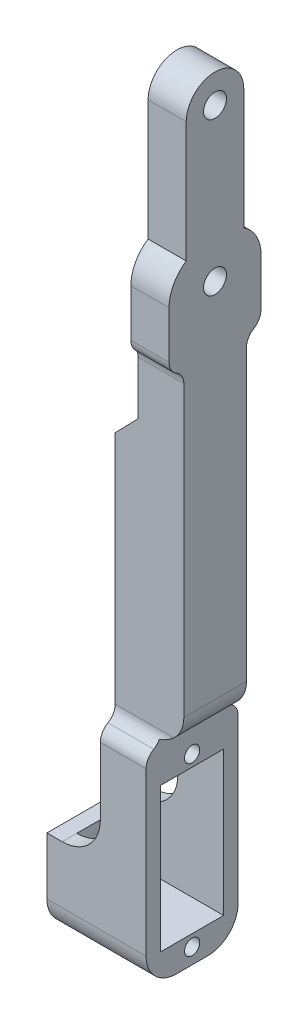
from build123d import *

# Parameters (mm, degrees)
SKETCH1_R               = 10
SKETCH1_R_2             = 0.8
SKETCH1_R_3             = 3.301767793
BOSS_EXTRUDE1_DEPTH     = 1.5
SKETCH2_R               = 10
BOSS_EXTRUDE2_DEPTH     = 9
CUT_EXTRUDE1_DEPTH      = 93.583714931
CUT_EXTRUDE1_DEPTH_BACK = 93.583714931
SKETCH3_R               = 1.5
FILLET1_R               = 5
SKETCH4_R               = 1.5
BOSS_EXTRUDE3_DEPTH     = 5
CUT_EXTRUDE2_DEPTH      = 4
FILLET3_R               = 2
SKETCH6_W               = 12.069016708
SKETCH6_H               = 36.150412664
BOSS_EXTRUDE4_DEPTH     = 9
CUT_EXTRUDE3_DEPTH      = 112.059195252
CUT_EXTRUDE3_DEPTH_BACK = 112.059195252
CUT_EXTRUDE4_DEPTH      = 111.336877259
CUT_EXTRUDE4_DEPTH_BACK = 111.336877259
SKETCH8_R               = 1
SKETCH8_W               = 8.25
SKETCH8_H               = 18.9
FILLET4_R               = 4
SKETCH9_W               = 24.382356312
SKETCH9_H               = 35.371587325
CUT_EXTRUDE5_DEPTH      = 3
FILLET5_R               = 4
SKETCH10_R              = 20.065343601
CUT_EXTRUDE6_DEPTH      = 3
CUT_EXTRUDE7_DEPTH      = 111.33687725
CUT_EXTRUDE7_DEPTH_BACK = 111.33687725
FILLET6_R               = 2
CHAMFER1_SIZE           = 3
BOSS_EXTRUDE5_START     = 7
SKETCH12_R              = 1
BOSS_EXTRUDE5_DEPTH     = 7
SKETCH13_W              = 8.25
SKETCH13_H              = 7.955873605
CUT_EXTRUDE8_DEPTH      = 5
FILLET7_R               = 5
SKETCH14_W              = 2.593812074
SKETCH14_H              = 55.177011507
CUT_EXTRUDE9_DEPTH      = 2.5


# Some blends are built 0.0001 mm under size
with BuildPart() as part:
    # Sketch1 → Boss-Extrude1 (new body)
    with BuildSketch(Plane(origin=(0, 0, 0), x_dir=(0, 0, -1), z_dir=(1, 0, 0))):
        with Locations((2.983378847, 10.826778074)):
            Circle(SKETCH1_R)
        with Locations((2.983378847, 18.576778074)):
            Circle(SKETCH1_R_2, mode=Mode.SUBTRACT)
        with Locations((2.983378847, 3.076778074)):
            Circle(SKETCH1_R_2, mode=Mode.SUBTRACT)
        with Locations((-3.266621153, 10.826778074)):
            Circle(SKETCH1_R_2, mode=Mode.SUBTRACT)
        with Locations((9.233378847, 10.826778074)):
            Circle(SKETCH1_R_2, mode=Mode.SUBTRACT)
        with Locations((2.983378847, 10.826778074)):
            Circle(SKETCH1_R_3, mode=Mode.SUBTRACT)
    extrude(amount=BOSS_EXTRUDE1_DEPTH)

    # Sketch2 → Boss-Extrude2 (add)
    with BuildSketch(Plane.ZY):
        with BuildLine():
            Line((-15.531923741, 90.826778074), (9.565166047, 90.826778074))
            Line((9.565166047, 90.826778074), (9.565166047, 10.826778074))
            ThreePointArc((9.565166047, 10.826778074), (-2.983378847, -1.721766821), (-15.531923741, 10.826778074))
            Line((-15.531923741, 10.826778074), (-15.531923741, 90.826778074))
        make_face()
        with Locations((-2.983378847, 10.826778074)):
            Circle(SKETCH2_R, mode=Mode.SUBTRACT)
    extrude(amount=-BOSS_EXTRUDE2_DEPTH)

    # Sketch3 → Cut-Extrude1 (cut, two sides: drawn at the far end of the back side and taken through both)
    with BuildSketch(Plane(origin=(9, 0, 0), x_dir=(0, 0, -1), z_dir=(1, 0, 0)).offset(-CUT_EXTRUDE1_DEPTH_BACK)):
        with Locations((2.983378847, 85.826778074)):
            Circle(SKETCH3_R)
        with BuildLine():
            Line((-3.051129507, 36.150412664), (-3.051129507, 97.572569437))
            Line((-3.051129507, 97.572569437), (-16.389018159, 97.572569437))
            Line((-16.389018159, 97.572569437), (-16.389018159, 8.14109285))
            Line((-16.389018159, 8.14109285), (-9.565166047, 10.826778074))
            add(Edge.make_bspline(
                [(-9.565166047, 10.826778074), (-9.644230884, 15.122204253), (-6.916245701, 23.507010268), (-3.42826878, 31.561714956), (-3.051129507, 36.150412664)],
                knots=[0, 0, 0, 0, 0.482384809, 1, 1, 1, 1], degree=3))
        make_face()
        with BuildLine():
            Line((22.355775853, 8.14109285), (15.531923741, 10.826778074))
            add(Edge.make_bspline(
                [(15.531923741, 10.826778074), (15.610988578, 15.122204253), (12.883003395, 23.507010268), (9.395026474, 31.561714956), (9.017887201, 36.150412664)],
                knots=[0, 0, 0, 0, 0.482384809, 1, 1, 1, 1], degree=3))
            Line((9.017887201, 36.150412664), (9.017887201, 97.572569437))
            Line((9.017887201, 97.572569437), (22.355775853, 97.572569437))
            Line((22.355775853, 97.572569437), (22.355775853, 8.14109285))
        make_face()
    extrude(amount=CUT_EXTRUDE1_DEPTH + CUT_EXTRUDE1_DEPTH_BACK, mode=Mode.SUBTRACT)

    # Fillet1
    fillet1_edges = [part.edges().sort_by_distance(p)[0] for p in [
        (4.5, 90.826778074, 3.051129507),
        (4.5, 90.826778074, -9.017887201),
    ]]
    fillet(fillet1_edges, radius=FILLET1_R)

    # Sketch4 → Boss-Extrude3 (add)
    with BuildSketch(Plane(origin=(9, 0, 0), x_dir=(0, 0, -1), z_dir=(1, 0, 0))):
        with BuildLine():
            Line((-0.788675957, 85.826778074), (-0.788675957, 105.826778074))
            ThreePointArc((-0.788675957, 105.826778074), (2.983378847, 109.598832877), (6.755433651, 105.826778074))
            Line((6.755433651, 105.826778074), (6.755433651, 85.826778074))
            ThreePointArc((6.755433651, 85.826778074), (2.983378847, 82.05472327), (-0.788675957, 85.826778074))
        make_face()
        with Locations((2.983378847, 105.826778074)):
            Circle(SKETCH4_R, mode=Mode.SUBTRACT)
        with Locations((2.983378847, 85.826778074)):
            Circle(SKETCH4_R, mode=Mode.SUBTRACT)
    extrude(amount=-BOSS_EXTRUDE3_DEPTH)

    # Sketch5 → Cut-Extrude2 (cut)
    with BuildSketch(Plane.ZY):
        Polygon((3.051129507, 66.690354093), (-0.520583075, 90.618436978), (8.994411849, 90.618436978), (4.452818785, 66.690354093), align=None)
        Polygon((-9.017887201, 66.690354093), (-5.446174619, 90.618436978), (-12.469802715, 95.280611626), (-31.447569196, 66.690354093), align=None)
    extrude(amount=-CUT_EXTRUDE2_DEPTH, mode=Mode.SUBTRACT)

    # Fillet3
    fillet3_edges = [part.edges().sort_by_distance(p)[0] for p in [
        (2, 90.618436978, -5.446174619),
        (2, 90.618436978, -0.520583075),
    ]]
    fillet(fillet3_edges, radius=FILLET3_R)

    # Sketch6 → Boss-Extrude4 (add)
    with BuildSketch(Plane(origin=(9, 0, 0), x_dir=(0, 0, -1), z_dir=(1, 0, 0))):
        with Locations((2.983378847, 18.075206332)):
            Rectangle(SKETCH6_W, SKETCH6_H)
    extrude(amount=-BOSS_EXTRUDE4_DEPTH)

    # Sketch7 → Cut-Extrude3 (cut, two sides: drawn at the far end of the back side and taken through both)
    with BuildSketch(Plane(origin=(9, 0, 0), x_dir=(0, 0, -1), z_dir=(1, 0, 0)).offset(-CUT_EXTRUDE3_DEPTH_BACK)):
        Polygon((-3.051129507, -1.9847985), (-23.499593466, -1.9847985), (-3.051129507, 36.150412664), (-3.051129507, 6.693164213), (9.017887201, 6.693164213), (9.017887201, 36.150412664), (33.091996179, 2.744303699), (9.017887201, -7.659721138), align=None)
    extrude(amount=CUT_EXTRUDE3_DEPTH + CUT_EXTRUDE3_DEPTH_BACK, mode=Mode.SUBTRACT)

    # Sketch8 → Cut-Extrude4 (cut, two sides: drawn at the far end of the back side and taken through both)
    with BuildSketch(Plane(origin=(9, 0, 0), x_dir=(0, 0, -1), z_dir=(1, 0, 0)).offset(-CUT_EXTRUDE4_DEPTH_BACK)):
        with Locations((2.983378847, 30.648164213)):
            Circle(SKETCH8_R)
        with Locations((2.983378847, 8.738164213)):
            Circle(SKETCH8_R)
        with Locations((2.983378847, 19.693164213)):
            Rectangle(SKETCH8_W, SKETCH8_H)
    extrude(amount=CUT_EXTRUDE4_DEPTH + CUT_EXTRUDE4_DEPTH_BACK, mode=Mode.SUBTRACT)

    # Fillet4
    fillet4_edges = [part.edges().sort_by_distance(p)[0] for p in [
        (4.5, 6.693164213, -9.017887201),
        (4.5, 6.693164213, 3.051129507),
    ]]
    fillet(fillet4_edges, radius=FILLET4_R)

    # Sketch9 → Cut-Extrude5 (cut)
    with BuildSketch(Plane(origin=(9, 0, 0), x_dir=(0, 0, -1), z_dir=(1, 0, 0))):
        with Locations((3.21232116, 16.771571926)):
            Rectangle(SKETCH9_W, SKETCH9_H)
    extrude(amount=-CUT_EXTRUDE5_DEPTH, mode=Mode.SUBTRACT)

    # Fillet5
    # the kernel refuses this fillet: 4 mm, written as the material it takes off along each edge
    with BuildSketch(Plane(origin=(9, 34.457365588, -18.700345567), x_dir=(0, 1, 0), z_dir=(0, 0, 1))) as fillet5_piece_1:
        with BuildLine():
            CenterArc((3.872983346, 4), FILLET5_R, 194.477512186, 75.522487814)
            Line((0, 3), (-0.077459667, 2.98))
            ThreePointArc((-0.077459667, 2.98), (-0.08, 1.5), (-0.08, 0))
            Line((-0.08, 0), (0, -0.08))
            Line((0, -0.08), (3.872983346, -0.08))
            Line((3.872983346, -0.08), (3.872983346, 0))
        make_face()
    extrude(amount=31.43393344, mode=Mode.SUBTRACT)

    # Sketch10 → Cut-Extrude6 (cut)
    with BuildSketch(Plane.ZY):
        with Locations((-2.983378847, 85.826778074)):
            Circle(SKETCH10_R)
    extrude(amount=-CUT_EXTRUDE6_DEPTH, mode=Mode.SUBTRACT)

    # Sketch11 → Cut-Extrude7 (cut, two sides: drawn at the far end of the back side and taken through both)
    with BuildSketch(Plane.ZY.offset(-CUT_EXTRUDE7_DEPTH_BACK)):
        with BuildLine():
            Line((-7.109989343, 76.258566083), (-7.109989343, 35.357320381))
            ThreePointArc((-7.109989343, 35.357320381), (-9.017887201, 33.449422522), (-10.925785059, 35.357320381))
            Line((-10.925785059, 35.357320381), (-10.925785059, 76.258566083))
            ThreePointArc((-10.925785059, 76.258566083), (-9.017887201, 78.166463942), (-7.109989343, 76.258566083))
        make_face()
        with BuildLine():
            Line((1.103749815, 76.258566083), (1.103749815, 35.357320381))
            ThreePointArc((1.103749815, 35.357320381), (3.011647673, 33.449422522), (4.919545531, 35.357320381))
            Line((4.919545531, 35.357320381), (4.919545531, 76.258566083))
            ThreePointArc((4.919545531, 76.258566083), (3.011647673, 78.166463942), (1.103749815, 76.258566083))
        make_face()
    extrude(amount=CUT_EXTRUDE7_DEPTH + CUT_EXTRUDE7_DEPTH_BACK, mode=Mode.SUBTRACT)

    # Fillet6
    fillet6_edges = [part.edges().sort_by_distance(p)[0] for p in [
        (3, 33.449422522, -9.017887201),
        (3, 33.449831083, 3.051129507),
        (6.5, 78.166463942, -9.017887201),
        (6.5, 78.166055381, 3.051129507),
    ]]
    fillet(fillet6_edges, radius=FILLET6_R)

    # Chamfer1
    chamfer1_edges = [part.edges().sort_by_distance(p)[0] for p in [
        (3, 65.761444608, -3.003546718),
    ]]
    chamfer(chamfer1_edges, length=CHAMFER1_SIZE - 0.0001)  # a hair under: the kernel refuses the full size

    # Sketch12 → Boss-Extrude5 (add)
    with BuildSketch(Plane.ZY.offset(BOSS_EXTRUDE5_START)):
        with BuildLine():
            Line((-5.017887201, 6.693164213), (-0.948870493, 6.693164213))
            ThreePointArc((-0.948870493, 6.693164213), (1.879556632, 7.864737088), (3.051129507, 10.693164213))
            Line((3.051129507, 10.693164213), (3.051129507, 18.199037818))
            Line((3.051129507, 18.199037818), (-9.017887201, 18.199037818))
            Line((-9.017887201, 18.199037818), (-9.017887201, 10.693164213))
            ThreePointArc((-9.017887201, 10.693164213), (-7.846314326, 7.864737088), (-5.017887201, 6.693164213))
        make_face()
        with Locations((-2.983378847, 8.738164213)):
            Circle(SKETCH12_R, mode=Mode.SUBTRACT)
        with Locations((-2.983378847, 15.738164213)):
            Circle(SKETCH12_R, mode=Mode.SUBTRACT)
    extrude(amount=-BOSS_EXTRUDE5_DEPTH)

    # Sketch13 → Cut-Extrude8 (cut)
    with BuildSketch(Plane(origin=(0, 0, 0), x_dir=(0, 0, -1), z_dir=(1, 0, 0))):
        with Locations((2.983378847, 14.221101016)):
            Rectangle(SKETCH13_W, SKETCH13_H)
    extrude(amount=-CUT_EXTRUDE8_DEPTH, mode=Mode.SUBTRACT)

    # Fillet7
    fillet7_edges = [part.edges().sort_by_distance(p)[0] for p in [
        (0, 18.199037818, -8.063133024),
        (0, 18.199037818, 2.09637533),
    ]]
    fillet(fillet7_edges, radius=FILLET7_R)

    # Sketch14 → Cut-Extrude9 (cut)
    with BuildSketch(Plane.ZY):
        with Locations((-3.056710113, 56.731669967)):
            Rectangle(SKETCH14_W, SKETCH14_H)
    extrude(amount=-CUT_EXTRUDE9_DEPTH, mode=Mode.SUBTRACT)


solid = part.part
